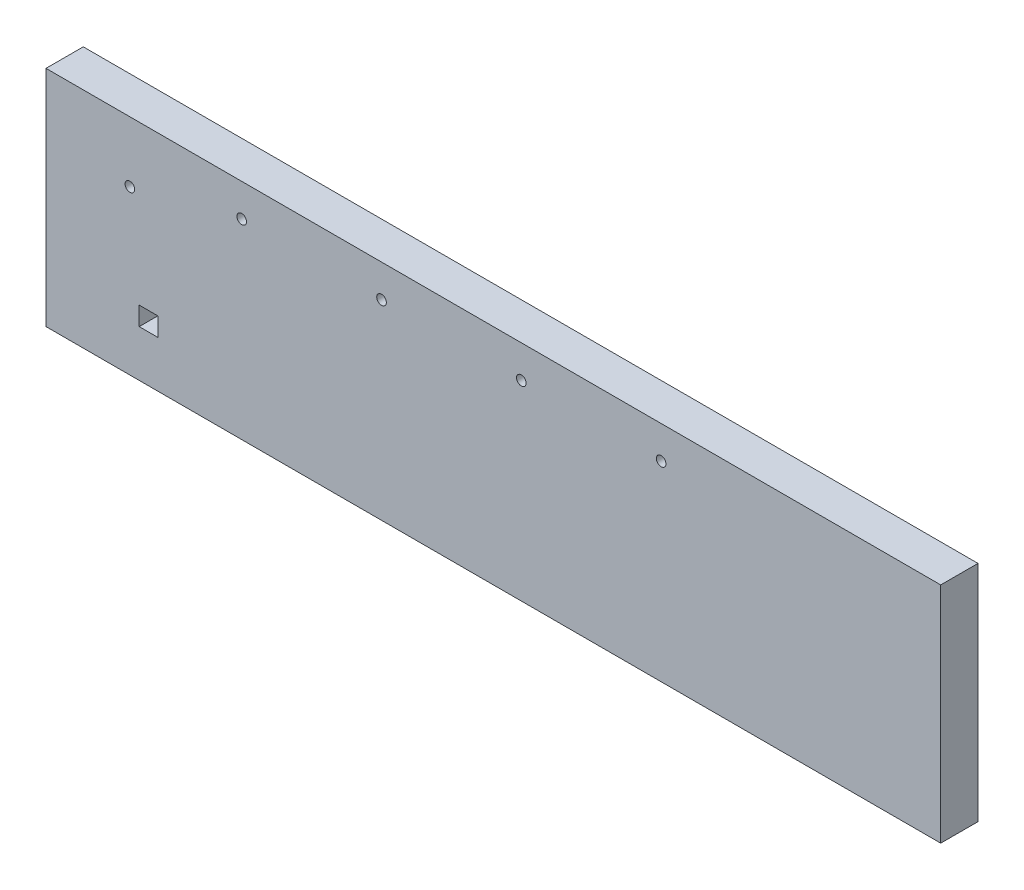
from build123d import *

# Parameters (mm, degrees)
SKETCH1_W           = 2438.4
SKETCH1_H           = 609.6
SKETCH1_R           = 13.119830451
SKETCH1_W_2         = 50.8
SKETCH1_H_2         = 50.8
BOSS_EXTRUDE1_DEPTH = 101.6
SKETCH2_W           = 127
SKETCH2_H           = 63.5
CUT_EXTRUDE1_DEPTH  = 50.8
SKETCH3_R           = 4.7625
CUT_EXTRUDE2_DEPTH  = 152.4


with BuildPart() as part:
    # Sketch1 → Boss-Extrude1 (new body)
    with BuildSketch(Plane.XY):
        Rectangle(SKETCH1_W, SKETCH1_H)
        with Locations((-990.6, 139.7)):
            Circle(SKETCH1_R, mode=Mode.SUBTRACT)
        with Locations((-685.8, 215.9)):
            Circle(SKETCH1_R, mode=Mode.SUBTRACT)
        with Locations((-304.8, 215.9)):
            Circle(SKETCH1_R, mode=Mode.SUBTRACT)
        with Locations((76.2, 215.9)):
            Circle(SKETCH1_R, mode=Mode.SUBTRACT)
        with Locations((457.2, 215.9)):
            Circle(SKETCH1_R, mode=Mode.SUBTRACT)
        with Locations((-939.8, -152.4)):
            Rectangle(SKETCH1_W_2, SKETCH1_H_2, mode=Mode.SUBTRACT)
    extrude(amount=BOSS_EXTRUDE1_DEPTH)

    # Sketch2 → Cut-Extrude1 (cut)
    with BuildSketch(Plane(origin=(0, 0, 0), x_dir=(-1, 0, 0), z_dir=(0, 0, -1))):
        with Locations((-774.7, -241.3)):
            Rectangle(SKETCH2_W, SKETCH2_H)
        with Locations((774.7, -241.3)):
            Rectangle(SKETCH2_W, SKETCH2_H)
        with Locations((774.7, 241.3)):
            Rectangle(SKETCH2_W, SKETCH2_H)
        with Locations((-774.7, 241.3)):
            Rectangle(SKETCH2_W, SKETCH2_H)
    extrude(amount=-CUT_EXTRUDE1_DEPTH, mode=Mode.SUBTRACT)

    # Sketch3 → Cut-Extrude2 (cut)
    with BuildSketch(Plane.XZ.offset(304.8)):
        with Locations((-742.95, 25.4)):
            Circle(SKETCH3_R)
        with Locations((-806.45, 25.4)):
            Circle(SKETCH3_R)
        with Locations((742.95, 25.4)):
            Circle(SKETCH3_R)
        with Locations((806.45, 25.4)):
            Circle(SKETCH3_R)
    extrude(amount=-CUT_EXTRUDE2_DEPTH, mode=Mode.SUBTRACT)


solid = part.part
